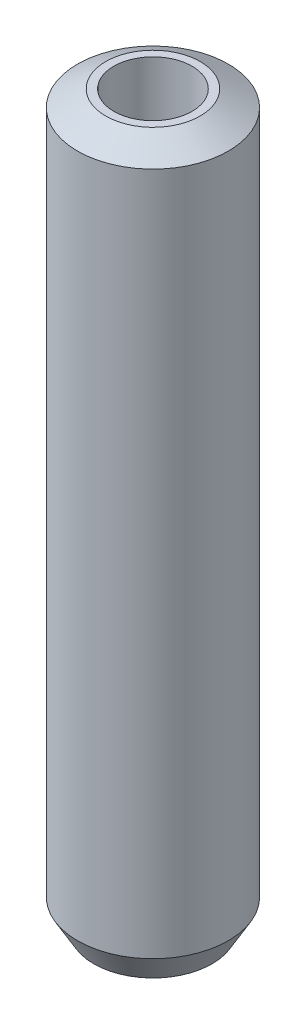
from build123d import *
from OCP.BRepFilletAPI import BRepFilletAPI_MakeChamfer

# Parameters (mm, degrees)
SKETCH1_R           = 17.5
BOSS_EXTRUDE1_DEPTH = 168.990619341
SKETCH2_R           = 9.081965723
CUT_EXTRUDE1_DEPTH  = 171.793235888
CHAMFER1_SIZE       = 3.777265011
CHAMFER1_SIZE2      = 6.542414914


with BuildPart() as part:
    # Sketch1 → Boss-Extrude1 (new body)
    with BuildSketch(Plane(origin=(0, 0, 0), x_dir=(1, 0, 0), z_dir=(0, 1, 0))):
        Circle(SKETCH1_R)
    extrude(amount=BOSS_EXTRUDE1_DEPTH)

    # Sketch2 → Cut-Extrude1 (cut, through all)
    with BuildSketch(Plane(origin=(0, 0, 0), x_dir=(1, 0, 0), z_dir=(0, 1, 0))):
        Circle(SKETCH2_R)
    extrude(amount=CUT_EXTRUDE1_DEPTH, mode=Mode.SUBTRACT)

    # Chamfer1: one chamfer whose edges measure the first distance from different faces: ONE call of the kernel's chamfer builder (chamfer() names one face for all edges)
    chamfer1_edges_1 = [part.edges().sort_by_distance(p)[0] for p in [
        (-17.5, 168.990619341, 0),
    ]]
    chamfer1_side_1 = [part.faces().sort_by_distance(p)[0] for p in [
        (-17.5, 84.49530967, 0),
    ]]
    chamfer1_edges_2 = [part.edges().sort_by_distance(p)[0] for p in [
        (-17.5, 0, 0),
    ]]
    chamfer1_side_2 = [part.faces().sort_by_distance(p)[0] for p in [
        (-17.005025253, 0, 0),
    ]]
    chamfer1 = BRepFilletAPI_MakeChamfer(part.part.solid().wrapped)
    for e in chamfer1_edges_1:
        chamfer1.Add(CHAMFER1_SIZE, CHAMFER1_SIZE2, e.wrapped, chamfer1_side_1[0].wrapped)  # the first distance lies on this face
    for e in chamfer1_edges_2:
        chamfer1.Add(CHAMFER1_SIZE, CHAMFER1_SIZE2, e.wrapped, chamfer1_side_2[0].wrapped)  # the first distance lies on this face
    add(Compound.cast(chamfer1.Shape()), mode=Mode.REPLACE)


solid = part.part
